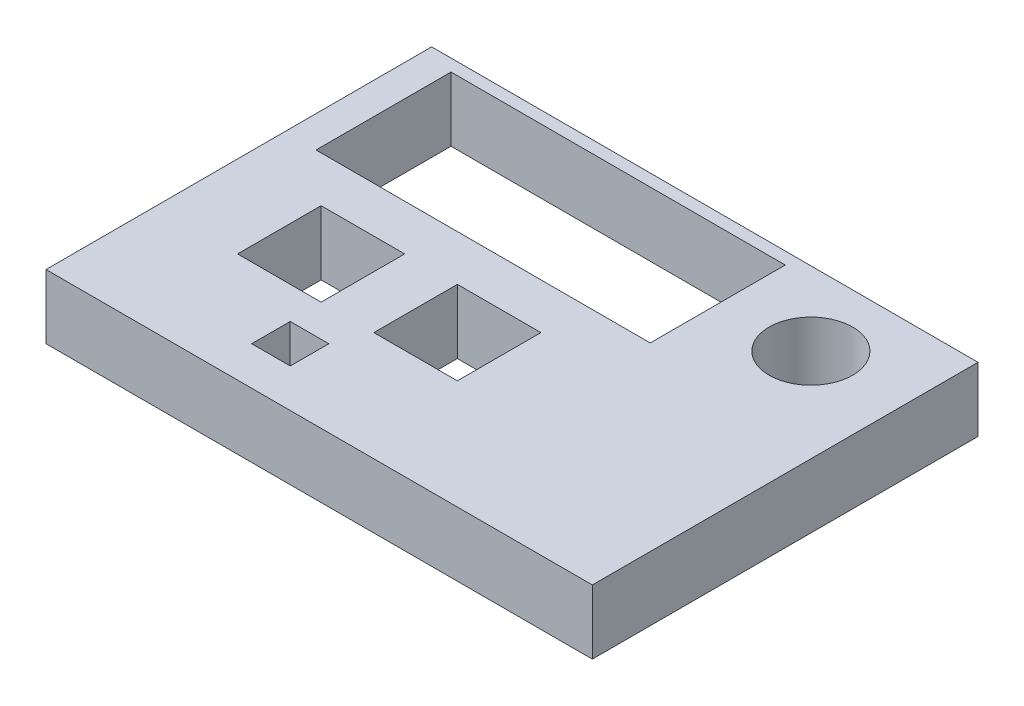
from build123d import *

# Parameters (mm, degrees)
SKETCH1_W           = 13
SKETCH1_H           = 13
SKETCH1_W_2         = 52
SKETCH1_H_2         = 21
SKETCH1_R           = 6.5
BOSS_EXTRUDE1_DEPTH = 10


with BuildPart() as part:
    # Sketch1 → Boss-Extrude1 (new body)
    with BuildSketch(Plane(origin=(0, 0, 0), x_dir=(1, 0, 0), z_dir=(0, 1, 0))):
        Polygon((-42.5, -13), (-42.5, -30), (-13.5, -30), (42.5, -30), (42.5, 30), (-42.5, 30), align=None)
        Polygon((-10.5, -24), (-13.5, -24), (-16.5, -24), (-16.5, -18), (-10.5, -18), align=None, mode=Mode.SUBTRACT)
        with Locations((-23.2, -6.5)):
            Rectangle(SKETCH1_W, SKETCH1_H, mode=Mode.SUBTRACT)
        with Locations((-2, -6.5)):
            Rectangle(SKETCH1_W, SKETCH1_H, mode=Mode.SUBTRACT)
        with Locations((-11.6, 17.61)):
            Rectangle(SKETCH1_W_2, SKETCH1_H_2, mode=Mode.SUBTRACT)
        with Locations((28, 18.5)):
            Circle(SKETCH1_R, mode=Mode.SUBTRACT)
    extrude(amount=BOSS_EXTRUDE1_DEPTH)


solid = part.part
